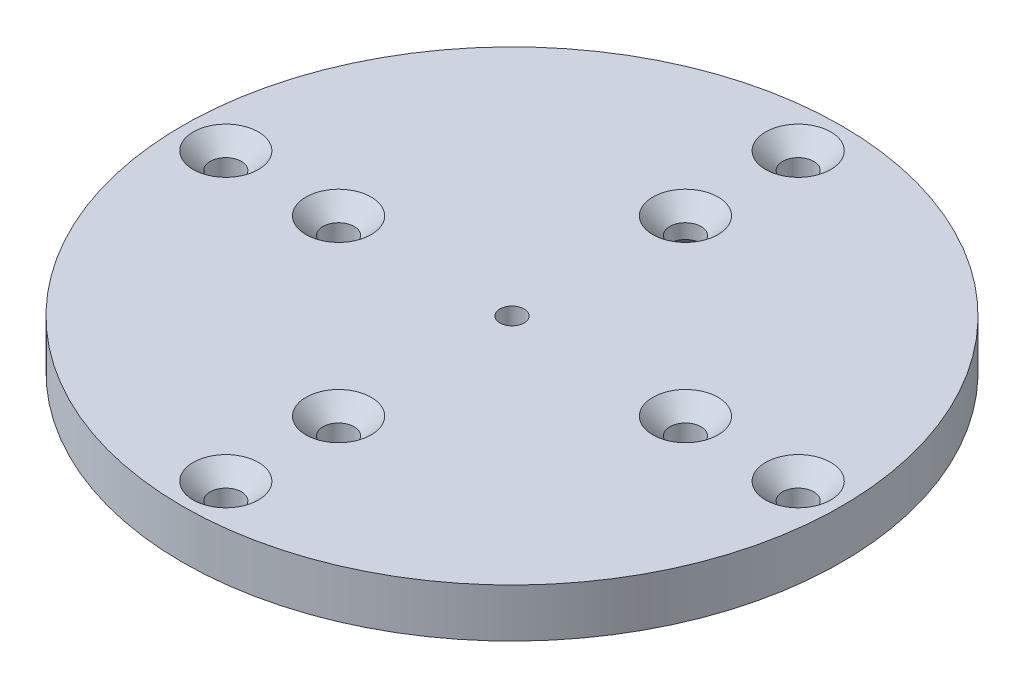
from build123d import *

# Parameters (mm, degrees)
SKETCH1_R                                           = 47.5
SKETCH1_R_2                                         = 35
BOSS_EXTRUDE1_DEPTH                                 = 7
SKETCH2_R                                           = 2.25
SKETCH2_R_2                                         = 1.75
CUT_EXTRUDE1_DEPTH                                  = 68.538877693
CSK_FOR_M4_COUNTERSUNK_FLAT_HEAD_SCREW1_D           = 4.5
CSK_FOR_M4_COUNTERSUNK_FLAT_HEAD_SCREW1_CSINK_D     = 9.4
CSK_FOR_M4_COUNTERSUNK_FLAT_HEAD_SCREW1_CSINK_ANGLE = 90
BOSS_EXTRUDE2_START                                 = -7
SKETCH4_R                                           = 35
BOSS_EXTRUDE2_DEPTH                                 = 7
SKETCH6_R                                           = 1.75
CUT_EXTRUDE2_DEPTH                                  = 30
SKETCH2_2_R                                         = 2.25
SKETCH2_2_R_2                                       = 1.75
CUT_EXTRUDE3_DEPTH                                  = 68.538877693


# Read off the part's stored shape, not the designer's step: CSK for M4 Countersunk Flat Head Screw2
with BuildPart() as part:
    # Sketch1 → Boss-Extrude1 (new body)
    with BuildSketch(Plane(origin=(0, 0, 0), x_dir=(1, 0, 0), z_dir=(0, 1, 0))):
        with Locations(Location((0, 0, 0), (0, 0, 270))):
            Circle(SKETCH1_R)
        with Locations(Location((0, 0, 0), (0, 0, 270))):
            Circle(SKETCH1_R_2, mode=Mode.SUBTRACT)
    extrude(amount=BOSS_EXTRUDE1_DEPTH)

    # Sketch2 → Cut-Extrude1 (cut, through all)
    with BuildSketch(Plane(origin=(0, 7, 0), x_dir=(1, 0, 0), z_dir=(0, 1, 0))):
        with Locations(Location((0, 41.25, 0), (0, 0, 270))):
            Circle(SKETCH2_R)
        with Locations(Location((41.25, 0, 0), (0, 0, 270))):
            Circle(SKETCH2_R)
        with Locations(Location((0, -41.25, 0), (0, 0, 90))):
            Circle(SKETCH2_R)
        with Locations(Location((-41.25, 0, 0), (0, 0, 90))):
            Circle(SKETCH2_R)
        with Locations((0, 25)):
            Circle(SKETCH2_R_2)
        with Locations((25, 0)):
            Circle(SKETCH2_R_2)
        with Locations((0, -25)):
            Circle(SKETCH2_R_2)
        with Locations((-25, 0)):
            Circle(SKETCH2_R_2)
    extrude(amount=-CUT_EXTRUDE1_DEPTH, mode=Mode.SUBTRACT)

    # CSK for M4 Countersunk Flat Head Screw1 (through all)
    with Locations(Plane(origin=(0, 7, 41.25), x_dir=(0, 0, 1), z_dir=(0, 1, 0))):
        with Locations((0, 0), (-41.25, 41.25), (-82.5, 0), (-41.25, -41.25)):
            CounterSinkHole(CSK_FOR_M4_COUNTERSUNK_FLAT_HEAD_SCREW1_D / 2, CSK_FOR_M4_COUNTERSUNK_FLAT_HEAD_SCREW1_CSINK_D / 2, counter_sink_angle=CSK_FOR_M4_COUNTERSUNK_FLAT_HEAD_SCREW1_CSINK_ANGLE)

    # Sketch4 → Boss-Extrude2 (add)
    with BuildSketch(Plane(origin=(0, 7, 0), x_dir=(1, 0, 0), z_dir=(0, 1, 0)).offset(BOSS_EXTRUDE2_START)):
        Circle(SKETCH4_R)
    extrude(amount=BOSS_EXTRUDE2_DEPTH)

    # Sketch6 → Cut-Extrude2 (cut)
    with BuildSketch(Plane(origin=(0, 7, 0), x_dir=(1, 0, 0), z_dir=(0, 1, 0))):
        with Locations(Location((0, 0, 0), (0, 0, 270))):
            Circle(SKETCH6_R)
    extrude(amount=-CUT_EXTRUDE2_DEPTH, mode=Mode.SUBTRACT)

    # Sketch2<2> → Cut-Extrude3 (cut, through all)
    with BuildSketch(Plane(origin=(0, 7, 0), x_dir=(1, 0, 0), z_dir=(0, 1, 0))):
        with Locations(Location((0, 41.25, 0), (0, 0, 270))):
            Circle(SKETCH2_2_R)
        with Locations(Location((41.25, 0, 0), (0, 0, 270))):
            Circle(SKETCH2_2_R)
        with Locations(Location((0, -41.25, 0), (0, 0, 270))):
            Circle(SKETCH2_2_R)
        with Locations(Location((-41.25, 0, 0), (0, 0, 270))):
            Circle(SKETCH2_2_R)
        with Locations(Location((0, 25, 0), (0, 0, 270))):
            Circle(SKETCH2_2_R_2)
        with Locations(Location((25, 0, 0), (0, 0, 270))):
            Circle(SKETCH2_2_R_2)
        with Locations(Location((0, -25, 0), (0, 0, 270))):
            Circle(SKETCH2_2_R_2)
        with Locations(Location((-25, 0, 0), (0, 0, 270))):
            Circle(SKETCH2_2_R_2)
    extrude(amount=-CUT_EXTRUDE3_DEPTH, mode=Mode.SUBTRACT)

    # CSK for M4 Countersunk Flat Head Scr 2 → CSK for M4 Countersunk Flat Head Screw2 (revolve, cut)
    with BuildSketch(Plane.XY.offset(-25)):
        Polygon((1.75, 0), (4.7, 0), (2.25, 2.45), (2.25, 4.55), (4.7, 7), (1.75, 7), align=None)
    revolve(axis=Axis((0, 0, -25), (0, 1, 0)), mode=Mode.SUBTRACT)

    # CSK for M4 Countersunk Flat Head Scr 3 o → CSK for M4 Countersunk Flat Head Scr 3 (revolve, cut)
    with BuildSketch(Plane(origin=(25, 0, 0), x_dir=(1, 0, 0), z_dir=(0, 0, 1))):
        Polygon((1.75, 0), (2.25, 0), (2.25, 4.55), (4.7, 7), (1.75, 7), align=None)
    revolve(axis=Axis((25, 0, 0), (0, 1, 0)), mode=Mode.SUBTRACT)

    # CSK for M4 Countersunk Flat Head Scr 4 o → CSK for M4 Countersunk Flat Head Scr 4 (revolve, cut)
    with BuildSketch(Plane.XY.offset(25)):
        Polygon((1.75, 0), (2.25, 0), (2.25, 4.55), (4.7, 7), (1.75, 7), align=None)
    revolve(axis=Axis((0, 0, 25), (0, 1, 0)), mode=Mode.SUBTRACT)

    # CSK for M4 Countersunk Flat Head Scr 5 o → CSK for M4 Countersunk Flat Head Scr 5 (revolve, cut)
    with BuildSketch(Plane(origin=(-25, 0, 0), x_dir=(1, 0, 0), z_dir=(0, 0, 1))):
        Polygon((1.75, 0), (2.25, 0), (2.25, 4.55), (4.7, 7), (1.75, 7), align=None)
    revolve(axis=Axis((-25, 0, 0), (0, 1, 0)), mode=Mode.SUBTRACT)


solid = part.part
